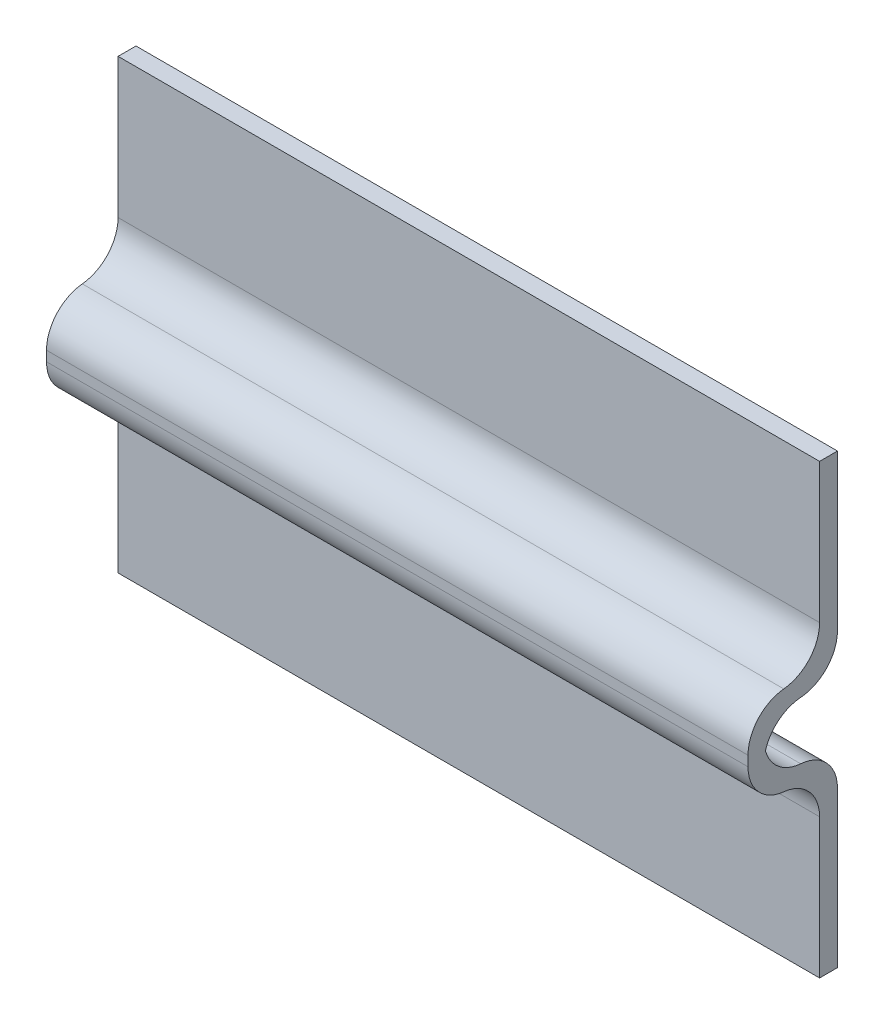
from build123d import *

# Parameters (mm, degrees)
SM_START               = -88.265
SM_BASE_FLANGE_1_DEPTH = 176.53
FILLET_3_R             = 10
FILLET_4_R             = 10
FILLET_5_R             = 10
FILLET_6_R             = 10
FILLET_7_R             = 10


# Read off the part's stored shape, not the designer's step: 基体-法兰1
with BuildPart() as part:
    # 基体-法兰1 outline → 基体-法兰1 (new body)
    with BuildSketch(Plane(origin=(0, 0, 0), x_dir=(0, 0, -1), z_dir=(1, 0, 0)).offset(SM_START)):
        Polygon((-4.503882243, 0), (0, 0), (0, 49.038822429), (-18.519411214, 49.038822429), (-18.519411214, 63.558233643), (0, 63.558233643), (0, 112.597056072), (-4.503882243, 112.597056072), (-4.503882243, 67.558233643), (-22.519411214, 67.558233643), (-22.519411214, 45.038822429), (-4.503882243, 45.038822429), align=None)
    extrude(amount=SM_BASE_FLANGE_1_DEPTH)

    # 圆角3
    fillet_3_edges = [part.edges().sort_by_distance(p)[0] for p in [
        (0, 45.038822429, 22.519411214),
        (0, 67.558233643, 22.519411214),
    ]]
    fillet(fillet_3_edges, radius=FILLET_3_R)

    # 圆角4
    # the kernel refuses this fillet: 10 mm, written as the material it adds along each edge
    with BuildSketch(Plane(origin=(-88.265, 49.038822429, 18.519411214), x_dir=(0, 1, 0), z_dir=(1, 0, 0)), Plane(origin=(-88.265, 63.558233643, 18.519411214), x_dir=(0, 0, -1), z_dir=(1, 0, 0))) as fillet_4_piece_1:
        with BuildLine():
            CenterArc((FILLET_4_R, -FILLET_4_R), FILLET_4_R, 90, 90)
            Line((0, -FILLET_4_R), (0, 0))
            Line((0, 0), (FILLET_4_R, 0))
        make_face()
    extrude(amount=176.53)

    # 圆角5
    fillet_5_edges = [part.edges().sort_by_distance(p)[0] for p in [
        (0, 63.558233643, 0),
        (0, 49.038822429, 0),
    ]]
    fillet(fillet_5_edges, radius=FILLET_5_R)

    # 圆角6
    fillet_6_edges = [part.edges().sort_by_distance(p)[0] for p in [
        (0, 45.038822429, 4.503882243),
    ]]
    fillet(fillet_6_edges, radius=FILLET_6_R)

    # 圆角7
    fillet_7_edges = [part.edges().sort_by_distance(p)[0] for p in [
        (0, 67.558233643, 4.503882243),
    ]]
    fillet(fillet_7_edges, radius=FILLET_7_R)


solid = part.part
